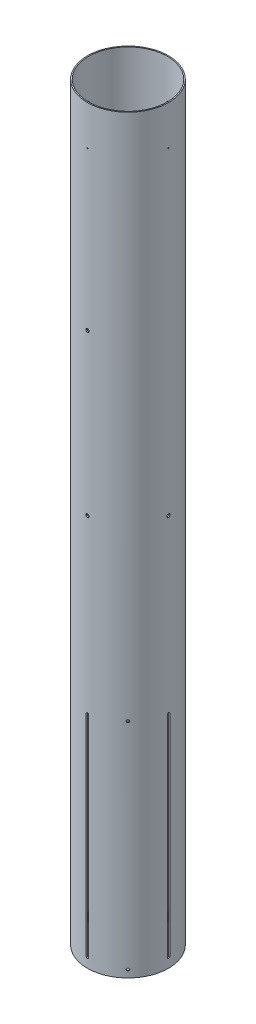
from build123d import *

# Parameters (mm, degrees)
SUSTAINER_TUBE_PROFILE_R       = 78.359
SUSTAINER_TUBE_PROFILE_R_2     = 76.2
SUSTAINER_TUBE_BODY_DEPTH      = 1447.8
FIN_SLOT_CUT_REACH             = 1460.364
FIN_SLOT_CUT_END_RADIUS        = 76.2
FIN_SLOT_PATTERN_COUNT         = 4
SKETCH1_R                      = 1.143
CUT_EXTRUDE1_DEPTH             = 1453.034815727
CIRPATTERN1_COUNT              = 4
CUT_EXTRUDE2_DEPTH             = 1453.034815727
CUT_EXTRUDE2_DEPTH_BACK        = 1453.034815727
SKETCH2_R                      = 3.175
SKETCH3_R                      = 3.175
CUT_EXTRUDE3_DEPTH             = 1453.034815727
CIRPATTERN2_COUNT              = 4
CUT_EXTRUDE4_REACH             = 1462.107
CUT_EXTRUDE4_END_RADIUS        = 76.2
SKETCH4_R                      = 2.5019
CUT_EXTRUDE4_DIRECTION_2_DEPTH = 1461.106899298


with BuildPart() as part:
    # Sustainer Tube Profile → Sustainer Tube Body (new body)
    with BuildSketch(Plane(origin=(0, 0, 0), x_dir=(1, 0, 0), z_dir=(0, 1, 0))):
        Circle(SUSTAINER_TUBE_PROFILE_R)
        Circle(SUSTAINER_TUBE_PROFILE_R_2, mode=Mode.SUBTRACT)
    extrude(amount=SUSTAINER_TUBE_BODY_DEPTH)

    # Fin Slot Cut: up to this cylinder (the profile starts outside it)
    fin_slot_cut_end = Plane(origin=(0, 222.25, 0), z_dir=(0, -1, 0)) * Cylinder(FIN_SLOT_CUT_END_RADIUS, 3074.128, mode=Mode.PRIVATE)
    # Fin Slot Profile → Fin Slot Cut (cut, up to the surface)
    with BuildSketch(Plane.XY.offset(78.359), mode=Mode.PRIVATE) as fin_slot_cut_sk1:
        with BuildLine():
            Line((-2.38125, 425.45), (-2.38125, 19.05))
            ThreePointArc((-2.38125, 19.05), (0, 16.66875), (2.38125, 19.05))
            Line((2.38125, 19.05), (2.38125, 425.45))
            ThreePointArc((2.38125, 425.45), (0, 427.83125), (-2.38125, 425.45))
        make_face()
    fin_slot_cut_tool1 = extrude(fin_slot_cut_sk1.sketch, amount=-FIN_SLOT_CUT_REACH, mode=Mode.PRIVATE) - fin_slot_cut_end
    fin_slot_cut = fin_slot_cut_tool1.solids().sort_by_distance((0, 222.25, 78.359))[0]
    add(fin_slot_cut, mode=Mode.SUBTRACT)

    # Fin Slot Pattern: Fin Slot Cut ×4 about axis
    fin_slot_pattern_axis = Axis((0, 1447.8, 0), (0, 1, 0))
    for i in range(1, FIN_SLOT_PATTERN_COUNT):
        add(fin_slot_cut.rotate(fin_slot_pattern_axis, i * 360 / FIN_SLOT_PATTERN_COUNT), mode=Mode.SUBTRACT)

    # Sketch1 → Cut-Extrude1 (cut, symmetric)
    with BuildSketch(Plane.XY):
        with Locations((0, 1371.6)):
            Circle(SKETCH1_R)
    cut_extrude1 = extrude(amount=CUT_EXTRUDE1_DEPTH, both=True, mode=Mode.SUBTRACT)

    # CirPattern1: Cut-Extrude1 ×4 about axis
    cirpattern1_axis = Axis((0, 1447.8, 0), (0, 1, 0))
    for i in range(1, CIRPATTERN1_COUNT):
        add(cut_extrude1.rotate(cirpattern1_axis, i * 360 / CIRPATTERN1_COUNT), mode=Mode.SUBTRACT)

    # Sketch2 → Cut-Extrude2 (cut, two sides: drawn at the far end of the back side and taken through both)
    with BuildSketch(Plane.XY.offset(-CUT_EXTRUDE2_DEPTH_BACK)):
        with Locations((0, 1066.8)):
            Circle(SKETCH2_R)
    extrude(amount=CUT_EXTRUDE2_DEPTH + CUT_EXTRUDE2_DEPTH_BACK, mode=Mode.SUBTRACT)

    # Sketch3 → Cut-Extrude3 (cut, symmetric)
    with BuildSketch(Plane.XY):
        with Locations((0, 756.9962)):
            Circle(SKETCH3_R)
    cut_extrude3 = extrude(amount=CUT_EXTRUDE3_DEPTH, both=True, mode=Mode.SUBTRACT)

    # CirPattern2: Cut-Extrude3 ×4 about axis
    cirpattern2_axis = Axis((0, 1447.8, 0), (0, 1, 0))
    for i in range(1, CIRPATTERN2_COUNT):
        add(cut_extrude3.rotate(cirpattern2_axis, i * 360 / CIRPATTERN2_COUNT), mode=Mode.SUBTRACT)

    # Cut-Extrude4: up to this cylinder (the profile starts outside it)
    cut_extrude4_end = Plane(origin=(0, 221.74454, 0), z_dir=(0, -1, 0)) * Cylinder(CUT_EXTRUDE4_END_RADIUS, 3493.01068, mode=Mode.PRIVATE)
    # Sketch4 → Cut-Extrude4 (cut, up to the surface)
    with BuildSketch(Plane(origin=(55.408180267, 0, 55.408180267), x_dir=(0, -1, 0), z_dir=(0.7071067811865488, 0, 0.7071067811865464)), mode=Mode.PRIVATE) as cut_extrude4_sk1:
        with Locations((-14.0462, 0)):
            Circle(SKETCH4_R)
    cut_extrude4_tool1 = extrude(cut_extrude4_sk1.sketch, amount=-CUT_EXTRUDE4_REACH, mode=Mode.PRIVATE) - cut_extrude4_end
    add(cut_extrude4_tool1.solids().sort_by_distance((55.40818, 14.0462, 55.40818))[0], mode=Mode.SUBTRACT)
    # Sketch4 → Cut-Extrude4 (cut, up to the surface)
    with BuildSketch(Plane(origin=(55.408180267, 0, 55.408180267), x_dir=(0, -1, 0), z_dir=(0.7071067811865488, 0, 0.7071067811865464)), mode=Mode.PRIVATE) as cut_extrude4_sk2:
        with Locations((-429.44288, 0)):
            Circle(SKETCH4_R)
    cut_extrude4_tool2 = extrude(cut_extrude4_sk2.sketch, amount=-CUT_EXTRUDE4_REACH, mode=Mode.PRIVATE) - cut_extrude4_end
    add(cut_extrude4_tool2.solids().sort_by_distance((55.40818, 429.44288, 55.40818))[0], mode=Mode.SUBTRACT)

    # Sketch4 → Cut-Extrude4 direction 2 (cut)
    with BuildSketch(Plane(origin=(55.408180267, 0, 55.408180267), x_dir=(0, -1, 0), z_dir=(0.7071067811865488, 0, 0.7071067811865464))):
        with Locations((-14.0462, 0)):
            Circle(SKETCH4_R)
        with Locations((-429.44288, 0)):
            Circle(SKETCH4_R)
    extrude(amount=CUT_EXTRUDE4_DIRECTION_2_DEPTH, mode=Mode.SUBTRACT)


solid = part.part
